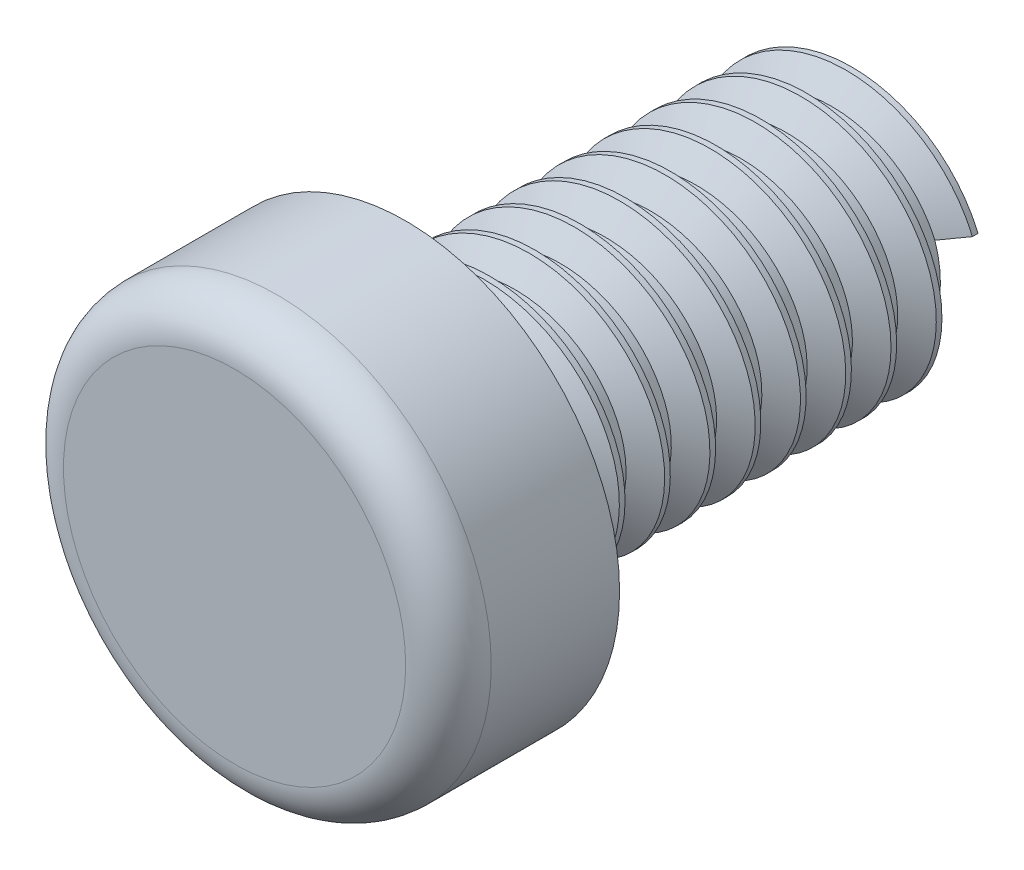
from build123d import *

# Parameters (mm, degrees)
SKETCH1_R           = 2.5
BOSS_EXTRUDE1_DEPTH = 10
THREAD1_PITCH       = 1.058333333
SKETCH4_R           = 5
BOSS_EXTRUDE2_DEPTH = 4
FILLET1_R           = 1


with BuildPart() as part:
    # Sketch1 → Boss-Extrude1 (new body)
    with BuildSketch(Plane.XY):
        Circle(SKETCH1_R)
    extrude(amount=BOSS_EXTRUDE1_DEPTH)

    # Thread1: the profile of Thread Profile1 profile screwed along a right-hand helix of 9.448819 turns, 8 arcs to a turn; built about Z, then put on its axis
    thread1_z = Axis((0, 0, 0), (0, 0, 1))
    thread1_corners = [(2.4997, 0, -0.000173205), (3.072839718, 0, 0.330729165), (3.072839718, 0, 0.463020832), (2.4997, 0, 0.793923202)]
    with BuildLine(mode=Mode.PRIVATE) as thread1_profile:
        Line(thread1_corners[0], thread1_corners[1])
        Line(thread1_corners[1], thread1_corners[2])
        Line(thread1_corners[2], thread1_corners[3])
        Line(thread1_corners[3], thread1_corners[0])
    thread1_cap = Face(thread1_profile.wire())
    thread1_turn_angles = [0, 22.5, 45, 67.5, 90, 112.5, 135, 157.5, 180, 202.5, 225, 247.5, 270, 292.5, 315, 337.5, 360]
    thread1_turn_weights = [1, 0.9238795325112867, 1, 0.9238795325112867, 1, 0.9238795325112867, 1, 0.9238795325112867, 1, 0.9238795325112867, 1, 0.9238795325112867, 1, 0.9238795325112867, 1, 0.9238795325112867, 1]
    thread1_turn_rails = [Edge.make_bspline([Vector(p[0], p[1], 0).rotate(thread1_z, thread1_turn_angles[k]) / thread1_turn_weights[k] + Vector(0, 0, p[2] + THREAD1_PITCH * thread1_turn_angles[k] / 360) for k in range(17)], [0, 0, 0, 1, 1, 2, 2, 3, 3, 4, 4, 5, 5, 6, 6, 7, 7, 8, 8, 8], 2, thread1_turn_weights) for p in thread1_corners]
    thread1_turn_sides = [Face.make_surface_from_curves(thread1_turn_rails[p[0]], thread1_turn_rails[p[1]]) for p in [(0, 1), (1, 2), (2, 3), (3, 0)]]
    thread1_last_angles = [3240, 3262.5, 3285, 3307.5, 3330, 3352.5, 3375, 3388.287401575, 3401.57480315]
    thread1_last_weights = [1, 0.9238795325112867, 1, 0.9238795325112867, 1, 0.9238795325112867, 1, 0.9732294335070495, 1]
    thread1_last_rails = [Edge.make_bspline([Vector(p[0], p[1], 0).rotate(thread1_z, thread1_last_angles[k]) / thread1_last_weights[k] + Vector(0, 0, p[2] + THREAD1_PITCH * thread1_last_angles[k] / 360) for k in range(9)], [0, 0, 0, 1, 1, 2, 2, 3, 3, 4, 4, 4], 2, thread1_last_weights) for p in thread1_corners]
    thread1_last_sides = [Face.make_surface_from_curves(thread1_last_rails[p[0]], thread1_last_rails[p[1]]) for p in [(0, 1), (1, 2), (2, 3), (3, 0)]]
    thread1 = Plane(origin=(0, 0, 10), x_dir=(-1, 0, 0), z_dir=(0, 0, -1)) * Solid(Shell([*[p.moved(Location((0, 0, THREAD1_PITCH * i))) for i in range(9) for p in thread1_turn_sides], *thread1_last_sides, thread1_cap, thread1_cap.rotate(thread1_z, 3401.57480315).moved(Location((0, 0, THREAD1_PITCH * 3401.57480315 / 360)))]))
    add(thread1)

    # Sketch4 → Boss-Extrude2 (add)
    with BuildSketch(Plane.XY.offset(10)):
        Circle(SKETCH4_R)
    extrude(amount=BOSS_EXTRUDE2_DEPTH)

    # Fillet1
    fillet1_edges = [part.edges().sort_by_distance(p)[0] for p in [
        (-5, 0, 14),
    ]]
    fillet(fillet1_edges, radius=FILLET1_R)


solid = part.part
